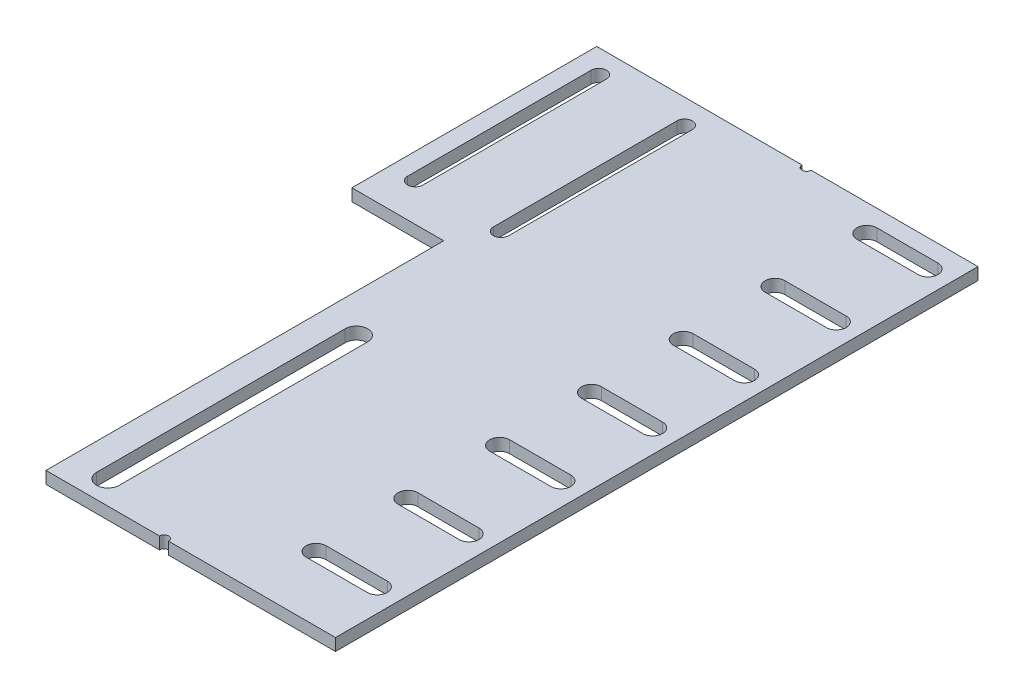
from build123d import *

# Parameters (mm, degrees)
CROQUIS1_W                = 60
CROQUIS1_H                = 160.023288417
SALIENTE_EXTRUIR1_DEPTH   = 7.9375
CROQUIS2_W                = 8.086078182
CROQUIS2_H                = 420
SALIENTE_EXTRUIR2_DEPTH   = 110
CORTAR_EXTRUIR1_DEPTH     = 10
CROQUIS4_W                = 184.389639933
CROQUIS4_H                = 520.028204804
CORTAR_EXTRUIR2_DEPTH     = 10
CONVERTIR_S_LIDO1_START   = -210
CONVERTIR_S_LIDO1_DEPTH   = 420
CONVERTIR_S_LIDO1_2_DEPTH = 420
CORTAR_EXTRUIR3_START     = -117.9375
CORTAR_EXTRUIR3_OUTLINE_W = 14.086078182
CORTAR_EXTRUIR3_OUTLINE_H = 420
CORTAR_EXTRUIR3_DEPTH     = 110
CORTAR_EXTRUIR3_START_2   = -7.9375
CORTAR_EXTRUIR3_2_DEPTH   = 7.9375
CORTAR_EXTRUIR3_3_DEPTH   = 7.9375


# Read off the part's stored shape, not the designer's step: Convertir-Sólido1, Cortar-Extruir3
with BuildPart() as part:
    # Croquis1 → Saliente-Extruir1 (new body)
    # profile 1 of 2: a face of its own
    with BuildSketch(Plane(origin=(0, 0, 0), x_dir=(1, 0, 0), z_dir=(0, 1, 0))):
        Polygon((75, 210), (-75, 210), (-75, 49.976711583), (-75, -210), (75, -210), align=None)
        with BuildLine():
            Line((-57.399097033, -162.050045053), (-57.399097033, -64.544827159))
            Line((-57.399097033, -64.544827159), (-57.399097033, -32.050045053))
            ThreePointArc((-57.399097033, -32.050045053), (-50.012947046, -24.663895066), (-42.626797059, -32.050045053))
            Line((-42.626797059, -32.050045053), (-42.626797059, -64.544827159))
            Line((-42.626797059, -64.544827159), (-42.626797059, -162.050045053))
            Line((-42.626797059, -162.050045053), (-42.626797059, -194.544827159))
            ThreePointArc((-42.626797059, -194.544827159), (-50.012947046, -201.930977146), (-57.399097033, -194.544827159))
            Line((-57.399097033, -194.544827159), (-57.399097033, -162.050045053))
        make_face(mode=Mode.SUBTRACT)
        with BuildLine():
            ThreePointArc((57.373202941, -194.544827159), (49.987052954, -201.930977146), (42.600902967, -194.544827159))
            Line((42.600902967, -194.544827159), (42.600902967, -162.050045053))
            ThreePointArc((42.600902967, -162.050045053), (49.987052954, -154.663895066), (57.373202941, -162.050045053))
            Line((57.373202941, -162.050045053), (57.373202941, -194.544827159))
        make_face(mode=Mode.SUBTRACT)
        with BuildLine():
            ThreePointArc((57.373202941, -64.544827159), (49.987052954, -71.930977146), (42.600902967, -64.544827159))
            Line((42.600902967, -64.544827159), (42.600902967, -32.050045053))
            ThreePointArc((42.600902967, -32.050045053), (49.987052954, -24.663895066), (57.373202941, -32.050045053))
            Line((57.373202941, -32.050045053), (57.373202941, -64.544827159))
        make_face(mode=Mode.SUBTRACT)
        with BuildLine():
            ThreePointArc((-66.642728039, 194.133584854), (-61.642728039, 199.133584854), (-56.642728039, 194.133584854))
            Line((-56.642728039, 194.133584854), (-56.642728039, 74.133584854))
            ThreePointArc((-56.642728039, 74.133584854), (-61.642728039, 69.133584854), (-66.642728039, 74.133584854))
            Line((-66.642728039, 74.133584854), (-66.642728039, 194.133584854))
        make_face(mode=Mode.SUBTRACT)
    # profile 2 of 2: a face of its own
    with BuildSketch(Plane(origin=(0, 0, 0), x_dir=(1, 0, 0), z_dir=(0, 1, 0))):
        with Locations((-105, 129.988355791)):
            Rectangle(CROQUIS1_W, CROQUIS1_H)
        with BuildLine():
            ThreePointArc((-123.366972213, 194.743931483), (-118.366972213, 199.743931483), (-113.366972213, 194.743931483))
            Line((-113.366972213, 194.743931483), (-113.366972213, 74.743931483))
            ThreePointArc((-113.366972213, 74.743931483), (-118.366972213, 69.743931483), (-123.366972213, 74.743931483))
            Line((-123.366972213, 74.743931483), (-123.366972213, 194.743931483))
        make_face(mode=Mode.SUBTRACT)
    extrude(amount=SALIENTE_EXTRUIR1_DEPTH)

    # Croquis2 → Saliente-Extruir2 (add)
    with BuildSketch(Plane.XZ):
        with Locations((4.043039091, 0)):
            Rectangle(CROQUIS2_W, CROQUIS2_H)
    extrude(amount=SALIENTE_EXTRUIR2_DEPTH)

    # Croquis3 → Cortar-Extruir1 (cut)
    with BuildSketch(Plane.ZY):
        with BuildLine():
            Line((-185.90944112, -54.927638628), (-185.90944112, -94.927638628))
            ThreePointArc((-185.90944112, -94.927638628), (-192.40944112, -101.427638628), (-198.90944112, -94.927638628))
            Line((-198.90944112, -94.927638628), (-198.90944112, -54.927638628))
            ThreePointArc((-198.90944112, -54.927638628), (-192.40944112, -48.427638628), (-185.90944112, -54.927638628))
        make_face()
        with BuildLine():
            Line((-125.90944112, -54.927638628), (-125.90944112, -94.927638628))
            ThreePointArc((-125.90944112, -94.927638628), (-132.40944112, -101.427638628), (-138.90944112, -94.927638628))
            Line((-138.90944112, -94.927638628), (-138.90944112, -54.927638628))
            ThreePointArc((-138.90944112, -54.927638628), (-132.40944112, -48.427638628), (-125.90944112, -54.927638628))
        make_face()
        with BuildLine():
            Line((-65.90944112, -54.927638628), (-65.90944112, -94.927638628))
            ThreePointArc((-65.90944112, -94.927638628), (-72.40944112, -101.427638628), (-78.90944112, -94.927638628))
            Line((-78.90944112, -94.927638628), (-78.90944112, -54.927638628))
            ThreePointArc((-78.90944112, -54.927638628), (-72.40944112, -48.427638628), (-65.90944112, -54.927638628))
        make_face()
        with BuildLine():
            Line((-5.90944112, -54.927638628), (-5.90944112, -94.927638628))
            ThreePointArc((-5.90944112, -94.927638628), (-12.40944112, -101.427638628), (-18.90944112, -94.927638628))
            Line((-18.90944112, -94.927638628), (-18.90944112, -54.927638628))
            ThreePointArc((-18.90944112, -54.927638628), (-12.40944112, -48.427638628), (-5.90944112, -54.927638628))
        make_face()
        with BuildLine():
            Line((54.09055888, -54.927638628), (54.09055888, -94.927638628))
            ThreePointArc((54.09055888, -94.927638628), (47.59055888, -101.427638628), (41.09055888, -94.927638628))
            Line((41.09055888, -94.927638628), (41.09055888, -54.927638628))
            ThreePointArc((41.09055888, -54.927638628), (47.59055888, -48.427638628), (54.09055888, -54.927638628))
        make_face()
        with BuildLine():
            Line((114.09055888, -54.927638628), (114.09055888, -94.927638628))
            ThreePointArc((114.09055888, -94.927638628), (107.59055888, -101.427638628), (101.09055888, -94.927638628))
            Line((101.09055888, -94.927638628), (101.09055888, -54.927638628))
            ThreePointArc((101.09055888, -54.927638628), (107.59055888, -48.427638628), (114.09055888, -54.927638628))
        make_face()
        with BuildLine():
            Line((174.09055888, -54.927638628), (174.09055888, -94.927638628))
            ThreePointArc((174.09055888, -94.927638628), (167.59055888, -101.427638628), (161.09055888, -94.927638628))
            Line((161.09055888, -94.927638628), (161.09055888, -54.927638628))
            ThreePointArc((161.09055888, -54.927638628), (167.59055888, -48.427638628), (174.09055888, -54.927638628))
        make_face()
    extrude(amount=-CORTAR_EXTRUIR1_DEPTH, mode=Mode.SUBTRACT)

    # Croquis4 → Cortar-Extruir2 (cut)
    with BuildSketch(Plane.XZ):
        with Locations((100.280898149, 50.014102402)):
            Rectangle(CROQUIS4_W, CROQUIS4_H)
    extrude(amount=-CORTAR_EXTRUIR2_DEPTH, mode=Mode.SUBTRACT)

    # Convertir-Sólido1 outline → Convertir-Sólido1 (cut)
    with BuildSketch(Plane.XY.offset(CONVERTIR_S_LIDO1_START)):
        with BuildLine():
            Line((8.086078182, 7.9375), (-4.851421818, 7.9375))
            ThreePointArc((-4.851421818, 7.9375), (4.296772164, 4.148193982), (8.086078182, -5))
            Line((8.086078182, -5), (8.086078182, 7.9375))
        make_face()
        with BuildLine():
            Line((0, -110), (0.148578182, -110))
            Line((0.148578182, -110), (0.148578182, -5))
            ThreePointArc((0.148578182, -5), (0.11129463, -4.390536748), (0, -3.790162679))
            Line((0, -3.790162679), (0, -110))
        make_face()
    extrude(amount=CONVERTIR_S_LIDO1_DEPTH, mode=Mode.SUBTRACT)

    # Convertir-S_lido1 2 outline → Convertir-S_lido1 2 (add)
    with BuildSketch(Plane.XY.offset(CONVERTIR_S_LIDO1_START)):
        with BuildLine():
            ThreePointArc((-4.851421818, 0), (-1.773206962, -1.059873948), (0, -3.790162679))
            Line((0, -3.790162679), (0, 0))
            Line((0, 0), (-4.851421818, 0))
        make_face()
    extrude(amount=CONVERTIR_S_LIDO1_2_DEPTH)

    # Cortar-Extruir3 outline → Cortar-Extruir3 (cut)
    with BuildSketch(Plane(origin=(0, 7.9375, 0), x_dir=(1, 0, 0), z_dir=(0, 1, 0)).offset(CORTAR_EXTRUIR3_START)):
        with Locations((1.043039091, 0)):
            Rectangle(CORTAR_EXTRUIR3_OUTLINE_W, CORTAR_EXTRUIR3_OUTLINE_H)
    extrude(amount=CORTAR_EXTRUIR3_DEPTH, mode=Mode.SUBTRACT)

    # Cortar-Extruir3 2 outline → Cortar-Extruir3 2 (cut)
    with BuildSketch(Plane(origin=(0, 7.9375, 0), x_dir=(1, 0, 0), z_dir=(0, 1, 0)).offset(CORTAR_EXTRUIR3_START_2)):
        with BuildLine():
            Line((5.19261796, 210), (-0.80738204, 210))
            ThreePointArc((-0.80738204, 210), (2.19261796, 207), (5.19261796, 210))
        make_face()
        with BuildLine():
            Line((-0.80738204, -210), (5.19261796, -210))
            ThreePointArc((5.19261796, -210), (2.19261796, -207), (-0.80738204, -210))
        make_face()
    extrude(amount=CORTAR_EXTRUIR3_2_DEPTH, mode=Mode.SUBTRACT)

    # Cortar-Extruir3 3 outline → Cortar-Extruir3 3 (add)
    with BuildSketch(Plane(origin=(0, 7.9375, 0), x_dir=(1, 0, 0), z_dir=(0, 1, 0)).offset(CORTAR_EXTRUIR3_START_2)):
        with BuildLine():
            ThreePointArc((5.19261796, 210), (2.19261796, 207), (-0.80738204, 210))
            Line((-0.80738204, 210), (-6, 210))
            Line((-6, 210), (-6, -210))
            Line((-6, -210), (-0.80738204, -210))
            ThreePointArc((-0.80738204, -210), (2.19261796, -207), (5.19261796, -210))
            Line((5.19261796, -210), (114.236657738, -210))
            Line((114.236657738, -210), (114.236657738, 210))
            Line((114.236657738, 210), (5.19261796, 210))
        make_face()
        with BuildLine():
            Line((59.164296366, 198.90944112), (99.164296366, 198.90944112))
            ThreePointArc((99.164296366, 198.90944112), (105.664296366, 192.40944112), (99.164296366, 185.90944112))
            Line((99.164296366, 185.90944112), (59.164296366, 185.90944112))
            ThreePointArc((59.164296366, 185.90944112), (52.664296366, 192.40944112), (59.164296366, 198.90944112))
        make_face(mode=Mode.SUBTRACT)
        with BuildLine():
            Line((59.164296366, 138.90944112), (99.164296366, 138.90944112))
            ThreePointArc((99.164296366, 138.90944112), (105.664296366, 132.40944112), (99.164296366, 125.90944112))
            Line((99.164296366, 125.90944112), (59.164296366, 125.90944112))
            ThreePointArc((59.164296366, 125.90944112), (52.664296366, 132.40944112), (59.164296366, 138.90944112))
        make_face(mode=Mode.SUBTRACT)
        with BuildLine():
            Line((59.164296366, 78.90944112), (99.164296366, 78.90944112))
            ThreePointArc((99.164296366, 78.90944112), (105.664296366, 72.40944112), (99.164296366, 65.90944112))
            Line((99.164296366, 65.90944112), (59.164296366, 65.90944112))
            ThreePointArc((59.164296366, 65.90944112), (52.664296366, 72.40944112), (59.164296366, 78.90944112))
        make_face(mode=Mode.SUBTRACT)
        with BuildLine():
            Line((59.164296366, 18.90944112), (99.164296366, 18.90944112))
            ThreePointArc((99.164296366, 18.90944112), (105.664296366, 12.40944112), (99.164296366, 5.90944112))
            Line((99.164296366, 5.90944112), (59.164296366, 5.90944112))
            ThreePointArc((59.164296366, 5.90944112), (52.664296366, 12.40944112), (59.164296366, 18.90944112))
        make_face(mode=Mode.SUBTRACT)
        with BuildLine():
            Line((59.164296366, -41.09055888), (99.164296366, -41.09055888))
            ThreePointArc((99.164296366, -41.09055888), (105.664296366, -47.59055888), (99.164296366, -54.09055888))
            Line((99.164296366, -54.09055888), (59.164296366, -54.09055888))
            ThreePointArc((59.164296366, -54.09055888), (52.664296366, -47.59055888), (59.164296366, -41.09055888))
        make_face(mode=Mode.SUBTRACT)
        with BuildLine():
            Line((59.164296366, -101.09055888), (99.164296366, -101.09055888))
            ThreePointArc((99.164296366, -101.09055888), (105.664296366, -107.59055888), (99.164296366, -114.09055888))
            Line((99.164296366, -114.09055888), (59.164296366, -114.09055888))
            ThreePointArc((59.164296366, -114.09055888), (52.664296366, -107.59055888), (59.164296366, -101.09055888))
        make_face(mode=Mode.SUBTRACT)
        with BuildLine():
            Line((59.164296366, -161.09055888), (99.164296366, -161.09055888))
            ThreePointArc((99.164296366, -161.09055888), (105.664296366, -167.59055888), (99.164296366, -174.09055888))
            Line((99.164296366, -174.09055888), (59.164296366, -174.09055888))
            ThreePointArc((59.164296366, -174.09055888), (52.664296366, -167.59055888), (59.164296366, -161.09055888))
        make_face(mode=Mode.SUBTRACT)
    extrude(amount=CORTAR_EXTRUIR3_3_DEPTH)


solid = part.part
